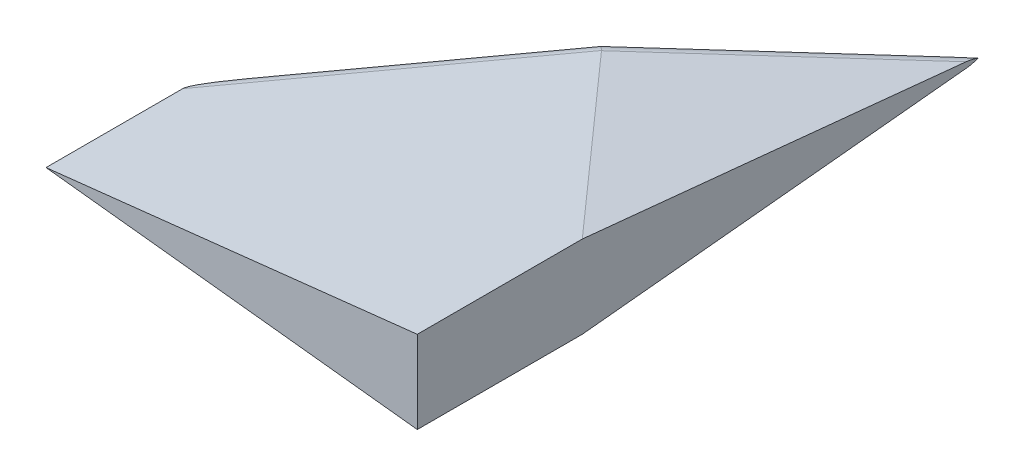
from build123d import *

# Parameters (mm, degrees)
BOSS_EXTRUDE1_DEPTH = 10
CUT_EXTRUDE1_DEPTH  = 58.879184514
CUT_EXTRUDE2_DEPTH  = 75.204110398
FILLET1_R           = 2.5


with BuildPart() as part:
    # Sketch1 → Boss-Extrude1 (new body)
    with BuildSketch(Plane(origin=(0, 0, 0), x_dir=(1, 0, 0), z_dir=(0, 1, 0))):
        Polygon((-22.5, -15), (22.5, 35), (22.5, -35), (-22.5, -35), align=None)
    extrude(amount=BOSS_EXTRUDE1_DEPTH)

    # Sketch2 → Cut-Extrude1 (cut, through all)
    with BuildSketch(Plane(origin=(22.5, 0, 0), x_dir=(0, 0, -1), z_dir=(1, 0, 0))):
        Polygon((35, 0), (35, 5), (-15, 0), align=None)
        Polygon((35, 10), (-15, 10), (35, 5), align=None)
    extrude(amount=-CUT_EXTRUDE1_DEPTH, mode=Mode.SUBTRACT)

    # Sketch3 → Cut-Extrude2 (cut, through all)
    with BuildSketch(Plane.XY.offset(35)):
        Polygon((-22.5, 10), (-22.5, 5), (22.5, 10), align=None)
        Polygon((-22.5, 0), (22.5, 0), (-22.5, 5), align=None)
    extrude(amount=-CUT_EXTRUDE2_DEPTH, mode=Mode.SUBTRACT)

    # Fillet1
    # the kernel refuses this fillet: 2.5 mm, written as the material it takes off along each edge
    with BuildSketch(Plane(origin=(-3.900636109, 2.066595988, -5.665959879), x_dir=(-0.049586965018551935, 0.9972489631508745, 0.0550966277983907), z_dir=(0.667124384994991, 0.07412493166611012, -0.7412493166611013)), Plane(origin=(26.400636109, 4.566595988, -39.334040121), x_dir=(-0.04958696501855178, -0.9972489631508747, 0.05509662779839086), z_dir=(-0.667124384994991, 0.07412493166611012, 0.7412493166611013))) as fillet1_piece_1:
        with BuildLine():
            CenterArc((FILLET1_R * 0.935510365796, FILLET1_R), FILLET1_R, 183.816685755, 86.183314245)
            Line((-FILLET1_R * 0.0622717598086, FILLET1_R * 0.93343552131), (0, 0))
            Line((0, 0), (FILLET1_R * 0.935510365796, 0))
        make_face()
    extrude(amount=45.420723481, mode=Mode.SUBTRACT)
    with BuildSketch(Plane(origin=(3.840238573, 7.926693175, -14.266931748), x_dir=(0.04958696501855149, -0.9972489631508746, -0.05509662779839123), z_dir=(-0.6671243849949912, -0.07412493166611021, 0.7412493166611013)), Plane(origin=(-26.340238573, 5.426693175, 19.266931748), x_dir=(0.04958696501855112, 0.9972489631508746, -0.05509662779839134), z_dir=(0.6671243849949912, -0.07412493166611005, -0.7412493166611013))) as fillet1_piece_2:
        with BuildLine():
            CenterArc((FILLET1_R * 0.921024902586, FILLET1_R), FILLET1_R, 184.708312873, 85.291687127)
            Line((-FILLET1_R * 0.0756005855297, FILLET1_R * 0.917916893107), (0, 0))
            Line((0, 0), (FILLET1_R * 0.921024902586, 0))
        make_face()
    extrude(amount=45.23965519, mode=Mode.SUBTRACT)


solid = part.part
